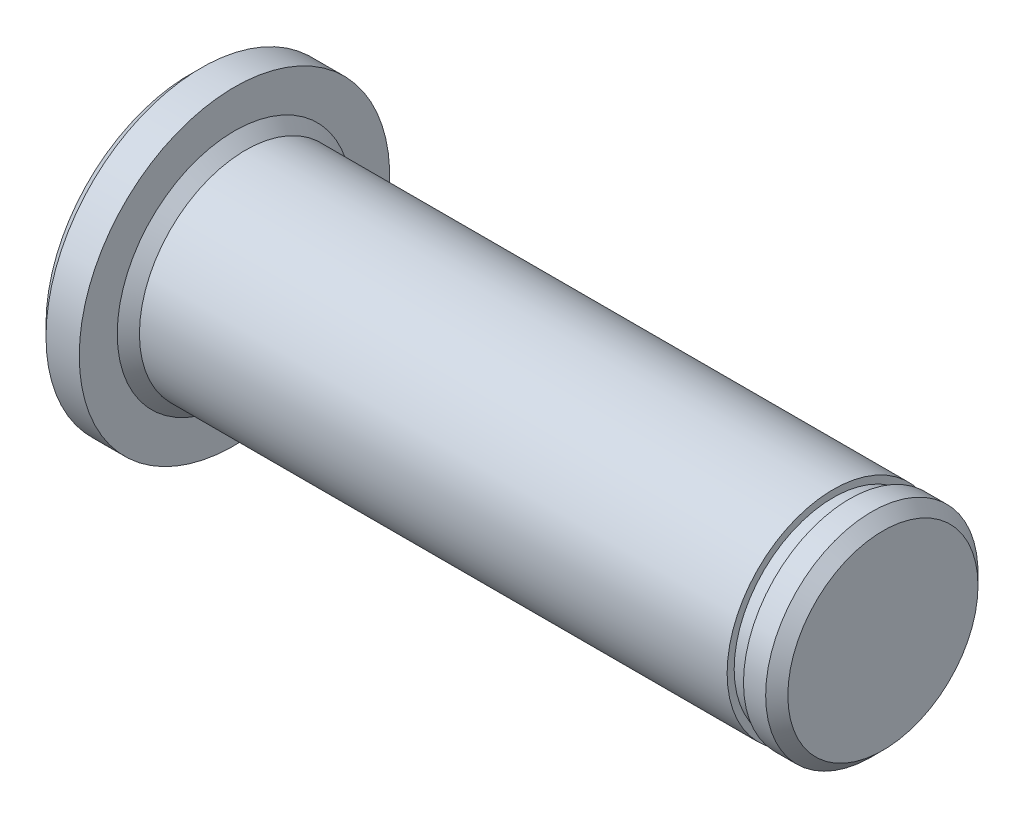
from build123d import *

# Parameters (mm, degrees)
CHAMFER1_SIZE = 0.5


with BuildPart() as part:
    # Sketch1 → Revolve1 (revolve)
    with BuildSketch(Plane.XY):
        Polygon((0, 4.7875), (0, 7), (-2, 7), (-2, 0), (29.237, 0), (29.237, 4.7875), (27.737, 4.7875), (27.737, 4.47), (27, 4.47), (27, 4.7875), align=None)
    revolve(axis=Axis((-78.535413295, 0, 0), (1, 0, 0)))

    # Chamfer1
    chamfer1_edges = [part.edges().sort_by_distance(p)[0] for p in [
        (-2, -7, 0),
        (0, -4.7875, 0),
        (29.237, -4.7875, 0),
    ]]
    chamfer(chamfer1_edges, length=CHAMFER1_SIZE)


solid = part.part
